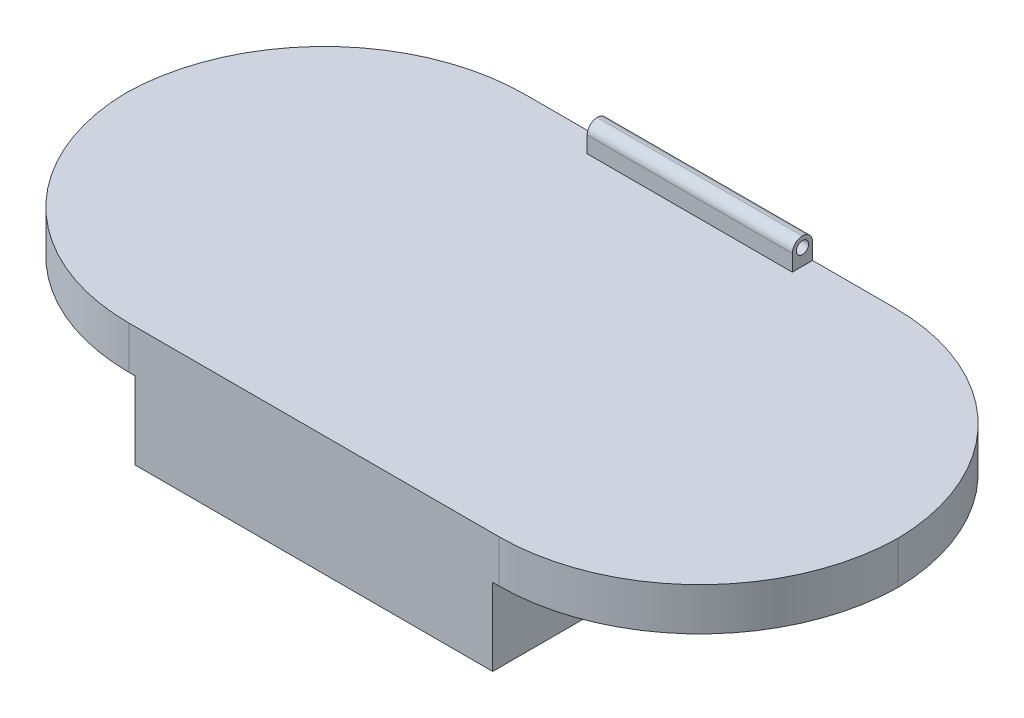
from build123d import *

# Parameters (mm, degrees)
SKETCH1_W           = 380
SKETCH1_H           = 195
BOSS_EXTRUDE1_DEPTH = 59
SKETCH2_W           = 195
SKETCH2_H           = 38
CUT_EXTRUDE1_DEPTH  = 102
FILLET1_R           = 99
SKETCH3_W           = 101
SKETCH3_H           = 10
BOSS_EXTRUDE2_DEPTH = 13
FILLET2_R           = 5
SKETCH4_R           = 3
CUT_EXTRUDE2_DEPTH  = 112


# Some blends are built 0.0001 mm under size
with BuildPart() as part:
    # Sketch1 → Boss-Extrude1 (new body)
    with BuildSketch(Plane(origin=(0, 0, 0), x_dir=(1, 0, 0), z_dir=(0, 1, 0))):
        Rectangle(SKETCH1_W, SKETCH1_H)
    extrude(amount=BOSS_EXTRUDE1_DEPTH)

    # Sketch2 → Cut-Extrude1 (cut)
    with BuildSketch(Plane(origin=(190, 0, 0), x_dir=(0, 0, -1), z_dir=(1, 0, 0))):
        with Locations((0, 19)):
            Rectangle(SKETCH2_W, SKETCH2_H)
    cut_extrude1 = extrude(amount=-CUT_EXTRUDE1_DEPTH, mode=Mode.SUBTRACT)

    # Mirror1: Cut-Extrude1 across plane
    add(cut_extrude1.mirror(Plane(origin=(0, 0, 0), x_dir=(0, 0, 1), z_dir=(1, 0, 0))), mode=Mode.SUBTRACT)

    # Fillet1
    # the kernel refuses this fillet: 99 mm, written as the material it takes off along each edge
    with BuildSketch(Plane(origin=(-190, -209.5, 97.5), x_dir=(0, 0, -1), z_dir=(0, 1, 0)), Plane(origin=(-190, -209.5, -97.5), x_dir=(1, 0, 0), z_dir=(0, 1, 0))) as fillet1_piece_1:
        with BuildLine():
            CenterArc((FILLET1_R, -FILLET1_R), FILLET1_R, 90, 90)
            Line((0, -FILLET1_R), (0, 0))
            Line((0, 0), (FILLET1_R, 0))
        make_face()
    extrude(amount=516, mode=Mode.SUBTRACT)
    with BuildSketch(Plane(origin=(190, -209.5, -97.5), x_dir=(-1, 0, 0), z_dir=(0, 1, 0)), Plane(origin=(190, -209.5, 97.5), x_dir=(0, 0, -1), z_dir=(0, 1, 0))) as fillet1_piece_2:
        with BuildLine():
            CenterArc((FILLET1_R, FILLET1_R), FILLET1_R, 180, 90)
            Line((0, FILLET1_R), (0, 0))
            Line((0, 0), (FILLET1_R, 0))
        make_face()
    extrude(amount=516, mode=Mode.SUBTRACT)

    # Sketch3 → Boss-Extrude2 (add)
    with BuildSketch(Plane(origin=(0, 59, 0), x_dir=(1, 0, 0), z_dir=(0, 1, 0))):
        with Locations((0, 92.5)):
            Rectangle(SKETCH3_W, SKETCH3_H)
    extrude(amount=BOSS_EXTRUDE2_DEPTH)

    # Fillet2
    fillet2_edges = [part.edges().sort_by_distance(p)[0] for p in [
        (0, 72, -97.5),
        (0, 72, -87.5),
    ]]
    fillet(fillet2_edges, radius=FILLET2_R - 0.0001)  # a hair under: the kernel refuses the full size

    # Sketch4 → Cut-Extrude2 (cut)
    with BuildSketch(Plane.ZY.offset(50.5)):
        with Locations((-92.5, 67)):
            Circle(SKETCH4_R)
    extrude(amount=-CUT_EXTRUDE2_DEPTH, mode=Mode.SUBTRACT)


solid = part.part
